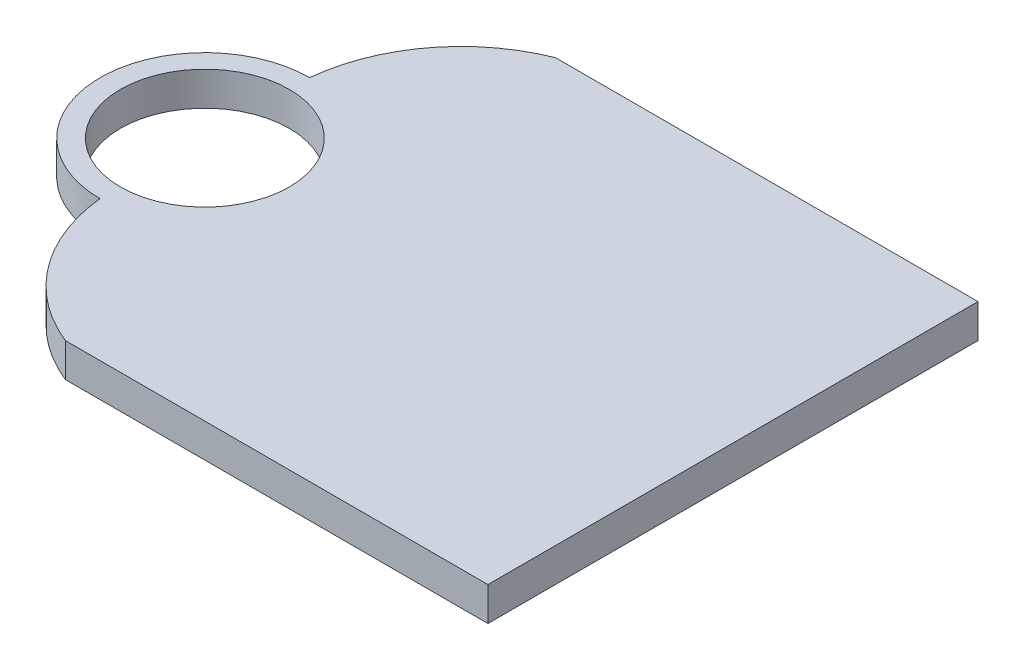
from build123d import *

# Parameters (mm, degrees)
SKETCH1_R           = 10
BOSS_EXTRUDE1_DEPTH = 4


with BuildPart() as part:
    # Sketch1 → Boss-Extrude1 (new body)
    with BuildSketch(Plane(origin=(0, -22.822027261, 0), x_dir=(1, 0, 0), z_dir=(0, 1, 0))):
        with BuildLine():
            ThreePointArc((0, -12.4), (3.924883766, -22.450840538), (12.5, -29))
            Line((12.5, -29), (62.5, -29))
            Line((62.5, -29), (62.5, 29))
            Line((62.5, 29), (12.5, 29))
            ThreePointArc((12.5, 29), (3.924883766, 22.450840538), (0, 12.4))
            ThreePointArc((0, 12.4), (-12.4, 0), (0, -12.4))
        make_face()
        Circle(SKETCH1_R, mode=Mode.SUBTRACT)
    extrude(amount=BOSS_EXTRUDE1_DEPTH)


solid = part.part
